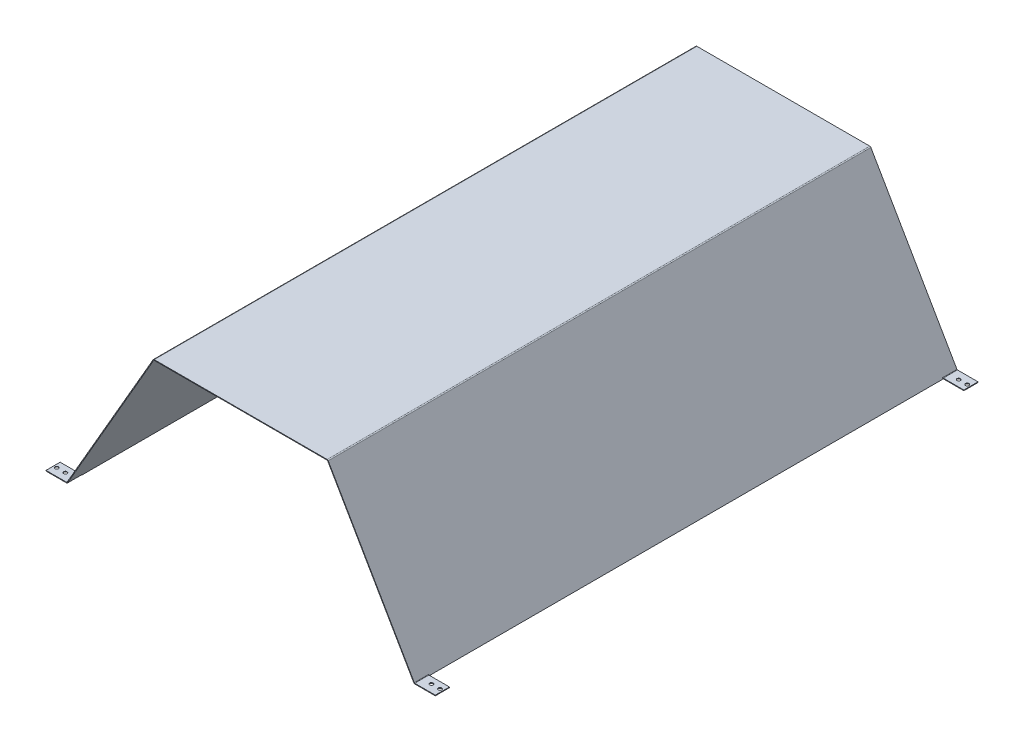
from build123d import *

# Parameters (mm, degrees)
EXTRUDE_1_DEPTH          = 633
EXTRUDE_1_DEPTH_BACK     = 633
SHEET_START              = -633
SHEET_METAL_1_DEPTH      = 1266
SHEET_METAL_1_2_DEPTH    = 1266
SM_START                 = -633
SM_EDGE_FLANGE_1_DEPTH   = 33.75
SM_START_2               = -600
SM_EDGE_FLANGE_1_2_DEPTH = 0.75
SM_EDGE_FLANGE_1_3_DEPTH = 33
MIRROR_START             = -633
MIRROR_2_COPY_1_DEPTH    = 33.75
MIRROR_START_2           = -600
MIRROR_2_COPY_2_DEPTH    = 0.75
MIRROR_2_COPY_3_DEPTH    = 33
MIRROR_2_COPY_4_DEPTH    = 0.75
MIRROR_2_COPY_5_DEPTH    = 33
CUT_EXTRUDE_1_REACH      = 856.061
SKETCH_9_R               = 4


# Read off the part's stored shape, not the designer's step: Преобразовать-Твердое тело1, Ребро-кромка1
with BuildPart() as part:
    # Sketch 1 → Вытянуть-Тонкостенный1 (new, two sides: drawn at the far end of the back side and taken through both)
    with BuildSketch(Plane.XY.offset(-EXTRUDE_1_DEPTH_BACK)):
        Polygon((405, 6), (202.5, 356.740288533), (-202.5, 356.740288533), (-405, 6), (-406.299038106, 6.75), (-203.366025404, 358.240288533), (203.366025404, 358.240288533), (406.299038106, 6.75), align=None)
    extrude(amount=EXTRUDE_1_DEPTH + EXTRUDE_1_DEPTH_BACK)

    # Sheet Metal 1 outline → Sheet Metal 1 (cut)
    with BuildSketch(Plane.XY.offset(SHEET_START)):
        with BuildLine():
            Line((203.366025404, 358.240288533), (201.633974596, 358.240288533))
            ThreePointArc((201.633974596, 358.240288533), (203.133974596, 357.838364744), (204.232050808, 356.740288533))
            Line((204.232050808, 356.740288533), (203.366025404, 358.240288533))
        make_face()
        with BuildLine():
            ThreePointArc((-204.232050808, 356.740288533), (-203.133974596, 357.838364744), (-201.633974596, 358.240288533))
            Line((-201.633974596, 358.240288533), (-203.366025404, 358.240288533))
            Line((-203.366025404, 358.240288533), (-204.232050808, 356.740288533))
        make_face()
    extrude(amount=SHEET_METAL_1_DEPTH, mode=Mode.SUBTRACT)

    # Sheet Metal 1 2 outline → Sheet Metal 1 2 (add)
    with BuildSketch(Plane.XY.offset(SHEET_START)):
        with BuildLine():
            Line((202.5, 356.740288533), (201.633974596, 356.740288533))
            ThreePointArc((201.633974596, 356.740288533), (202.383974596, 356.539326638), (202.933012702, 355.990288533))
            Line((202.933012702, 355.990288533), (202.5, 356.740288533))
        make_face()
        with BuildLine():
            ThreePointArc((-202.933012702, 355.990288533), (-202.383974596, 356.539326638), (-201.633974596, 356.740288533))
            Line((-201.633974596, 356.740288533), (-202.5, 356.740288533))
            Line((-202.5, 356.740288533), (-202.933012702, 355.990288533))
        make_face()
    extrude(amount=SHEET_METAL_1_2_DEPTH)

    # Ребро-кромка1 outline → Ребро-кромка1 (cut)
    with BuildSketch(Plane.XY.offset(SM_START)):
        with BuildLine():
            Line((-405, 6), (-403.700961894, 8.25))
            ThreePointArc((-403.700961894, 8.25), (-404.799038106, 7.151923789), (-406.299038106, 6.75))
            Line((-406.299038106, 6.75), (-405, 6))
        make_face()
    sm_edge_flange_1 = extrude(amount=SM_EDGE_FLANGE_1_DEPTH, mode=Mode.SUBTRACT)

    # Sm Edge Flange 1 2 outline → Sm Edge Flange 1 2 (cut)
    with BuildSketch(Plane.XY.offset(SM_START_2)):
        with BuildLine():
            Line((-403.325961894, 8.899519053), (-404.625, 9.649519053))
            Line((-404.625, 9.649519053), (-406.299038106, 6.75))
            ThreePointArc((-406.299038106, 6.75), (-404.799038106, 7.151923789), (-403.700961894, 8.25))
            Line((-403.700961894, 8.25), (-403.325961894, 8.899519053))
        make_face()
    sm_edge_flange_1_2 = extrude(amount=SM_EDGE_FLANGE_1_2_DEPTH, mode=Mode.SUBTRACT)

    # Sm Edge Flange 1 3 outline → Sm Edge Flange 1 3 (add)
    with BuildSketch(Plane.XY.offset(SM_START)):
        with BuildLine():
            Line((-406.299038106, 6.75), (-405, 9))
            ThreePointArc((-405, 9), (-405.549038106, 8.450961894), (-406.299038106, 8.25))
            Line((-406.299038106, 8.25), (-454.133974596, 8.25))
            Line((-454.133974596, 8.25), (-454.133974596, 6.75))
            Line((-454.133974596, 6.75), (-406.299038106, 6.75))
        make_face()
    sm_edge_flange_1_3 = extrude(amount=SM_EDGE_FLANGE_1_3_DEPTH)

    # Зеркальное отражение1: Ребро-кромка1, Sm Edge Flange 1 2, Sm Edge Flange 1 3 across plane
    add(sm_edge_flange_1.mirror(Plane.XY), mode=Mode.SUBTRACT)
    add(sm_edge_flange_1_2.mirror(Plane.XY), mode=Mode.SUBTRACT)
    add(sm_edge_flange_1_3.mirror(Plane.XY))

    # Зеркальное отражение2: Ребро-кромка1, Sm Edge Flange 1 2, Sm Edge Flange 1 3 across plane
    add(sm_edge_flange_1.mirror(Plane(origin=(0, 0, 0), x_dir=(0, 0, 1), z_dir=(1, 0, 0))), mode=Mode.SUBTRACT)
    add(sm_edge_flange_1_2.mirror(Plane(origin=(0, 0, 0), x_dir=(0, 0, 1), z_dir=(1, 0, 0))), mode=Mode.SUBTRACT)
    add(sm_edge_flange_1_3.mirror(Plane(origin=(0, 0, 0), x_dir=(0, 0, 1), z_dir=(1, 0, 0))))

    # Зеркальное отражение2 copy 1 sketch → Зеркальное отражение2 copy 1 (cut)
    with BuildSketch(Plane(origin=(0, 0, 0), x_dir=(-1, 0, 0), z_dir=(0, 0, -1)).offset(MIRROR_START)):
        with BuildLine():
            Line((-405, 6), (-403.700961894, 8.25))
            ThreePointArc((-403.700961894, 8.25), (-404.799038106, 7.151923789), (-406.299038106, 6.75))
            Line((-406.299038106, 6.75), (-405, 6))
        make_face()
    extrude(amount=MIRROR_2_COPY_1_DEPTH, mode=Mode.SUBTRACT)

    # Зеркальное отражение2 copy 2 sketch → Зеркальное отражение2 copy 2 (cut)
    with BuildSketch(Plane(origin=(0, 0, 0), x_dir=(-1, 0, 0), z_dir=(0, 0, -1)).offset(MIRROR_START_2)):
        with BuildLine():
            Line((-403.325961894, 8.899519053), (-404.625, 9.649519053))
            Line((-404.625, 9.649519053), (-406.299038106, 6.75))
            ThreePointArc((-406.299038106, 6.75), (-404.799038106, 7.151923789), (-403.700961894, 8.25))
            Line((-403.700961894, 8.25), (-403.325961894, 8.899519053))
        make_face()
    extrude(amount=MIRROR_2_COPY_2_DEPTH, mode=Mode.SUBTRACT)

    # Зеркальное отражение2 copy 3 sketch → Зеркальное отражение2 copy 3 (add)
    with BuildSketch(Plane(origin=(0, 0, 0), x_dir=(-1, 0, 0), z_dir=(0, 0, -1)).offset(MIRROR_START)):
        with BuildLine():
            Line((-406.299038106, 6.75), (-405, 9))
            ThreePointArc((-405, 9), (-405.549038106, 8.450961894), (-406.299038106, 8.25))
            Line((-406.299038106, 8.25), (-454.133974596, 8.25))
            Line((-454.133974596, 8.25), (-454.133974596, 6.75))
            Line((-454.133974596, 6.75), (-406.299038106, 6.75))
        make_face()
    extrude(amount=MIRROR_2_COPY_3_DEPTH)

    # Зеркальное отражение2 copy 4 sketch → Зеркальное отражение2 copy 4 (cut)
    with BuildSketch(Plane(origin=(0, 0, 0), x_dir=(-1, 0, 0), z_dir=(0, 0, 1)).offset(MIRROR_START_2)):
        with BuildLine():
            Line((-403.325961894, -8.899519053), (-404.625, -9.649519053))
            Line((-404.625, -9.649519053), (-406.299038106, -6.75))
            ThreePointArc((-406.299038106, -6.75), (-404.799038106, -7.151923789), (-403.700961894, -8.25))
            Line((-403.700961894, -8.25), (-403.325961894, -8.899519053))
        make_face()
    extrude(amount=MIRROR_2_COPY_4_DEPTH, mode=Mode.SUBTRACT)

    # Зеркальное отражение2 copy 5 sketch → Зеркальное отражение2 copy 5 (add)
    with BuildSketch(Plane(origin=(0, 0, 0), x_dir=(-1, 0, 0), z_dir=(0, 0, 1)).offset(MIRROR_START)):
        with BuildLine():
            Line((-406.299038106, -6.75), (-405, -9))
            ThreePointArc((-405, -9), (-405.549038106, -8.450961894), (-406.299038106, -8.25))
            Line((-406.299038106, -8.25), (-454.133974596, -8.25))
            Line((-454.133974596, -8.25), (-454.133974596, -6.75))
            Line((-454.133974596, -6.75), (-406.299038106, -6.75))
        make_face()
    extrude(amount=MIRROR_2_COPY_5_DEPTH)

    # Эскиз9 → Вырез-Вытянуть1 (cut, up to next)
    with BuildSketch(Plane(origin=(0, 8.25, 0), x_dir=(1, 0, 0), z_dir=(0, 1, 0)), mode=Mode.PRIVATE) as cut_extrude_1_sk1:
        with Locations(Location((-447, 615, 0), (0, 0, 180))):
            Circle(SKETCH_9_R)
    cut_extrude_1_tool1 = extrude(cut_extrude_1_sk1.sketch, amount=-CUT_EXTRUDE_1_REACH, mode=Mode.PRIVATE) & part.part
    # Эскиз9 → Вырез-Вытянуть1 (cut, up to next)
    with BuildSketch(Plane(origin=(0, 8.25, 0), x_dir=(1, 0, 0), z_dir=(0, 1, 0)), mode=Mode.PRIVATE) as cut_extrude_1_sk2:
        with Locations(Location((-427, 615, 0), (0, 0, 180))):
            Circle(SKETCH_9_R)
    cut_extrude_1_tool2 = extrude(cut_extrude_1_sk2.sketch, amount=-CUT_EXTRUDE_1_REACH, mode=Mode.PRIVATE) & part.part
    # Эскиз9 → Вырез-Вытянуть1 (cut, up to next)
    with BuildSketch(Plane(origin=(0, 8.25, 0), x_dir=(1, 0, 0), z_dir=(0, 1, 0)), mode=Mode.PRIVATE) as cut_extrude_1_sk3:
        with Locations(Location((-447, -615, 0), (0, 0, 180))):
            Circle(SKETCH_9_R)
    cut_extrude_1_tool3 = extrude(cut_extrude_1_sk3.sketch, amount=-CUT_EXTRUDE_1_REACH, mode=Mode.PRIVATE) & part.part
    # Эскиз9 → Вырез-Вытянуть1 (cut, up to next)
    with BuildSketch(Plane(origin=(0, 8.25, 0), x_dir=(1, 0, 0), z_dir=(0, 1, 0)), mode=Mode.PRIVATE) as cut_extrude_1_sk4:
        with Locations(Location((-427, -615, 0), (0, 0, 180))):
            Circle(SKETCH_9_R)
    cut_extrude_1_tool4 = extrude(cut_extrude_1_sk4.sketch, amount=-CUT_EXTRUDE_1_REACH, mode=Mode.PRIVATE) & part.part
    # Эскиз9 → Вырез-Вытянуть1 (cut, up to next)
    with BuildSketch(Plane(origin=(0, 8.25, 0), x_dir=(1, 0, 0), z_dir=(0, 1, 0)), mode=Mode.PRIVATE) as cut_extrude_1_sk5:
        with Locations(Location((427, -615, 0), (0, 0, 180))):
            Circle(SKETCH_9_R)
    cut_extrude_1_tool5 = extrude(cut_extrude_1_sk5.sketch, amount=-CUT_EXTRUDE_1_REACH, mode=Mode.PRIVATE) & part.part
    # Эскиз9 → Вырез-Вытянуть1 (cut, up to next)
    with BuildSketch(Plane(origin=(0, 8.25, 0), x_dir=(1, 0, 0), z_dir=(0, 1, 0)), mode=Mode.PRIVATE) as cut_extrude_1_sk6:
        with Locations(Location((447, -615, 0), (0, 0, 180))):
            Circle(SKETCH_9_R)
    cut_extrude_1_tool6 = extrude(cut_extrude_1_sk6.sketch, amount=-CUT_EXTRUDE_1_REACH, mode=Mode.PRIVATE) & part.part
    # Эскиз9 → Вырез-Вытянуть1 (cut, up to next)
    with BuildSketch(Plane(origin=(0, 8.25, 0), x_dir=(1, 0, 0), z_dir=(0, 1, 0)), mode=Mode.PRIVATE) as cut_extrude_1_sk7:
        with Locations(Location((427, 615, 0), (0, 0, 180))):
            Circle(SKETCH_9_R)
    cut_extrude_1_tool7 = extrude(cut_extrude_1_sk7.sketch, amount=-CUT_EXTRUDE_1_REACH, mode=Mode.PRIVATE) & part.part
    # Эскиз9 → Вырез-Вытянуть1 (cut, up to next)
    with BuildSketch(Plane(origin=(0, 8.25, 0), x_dir=(1, 0, 0), z_dir=(0, 1, 0)), mode=Mode.PRIVATE) as cut_extrude_1_sk8:
        with Locations(Location((447, 615, 0), (0, 0, 180))):
            Circle(SKETCH_9_R)
    cut_extrude_1_tool8 = extrude(cut_extrude_1_sk8.sketch, amount=-CUT_EXTRUDE_1_REACH, mode=Mode.PRIVATE) & part.part
    add(cut_extrude_1_tool1.solids().sort_by_distance((-447, 8.25, -615))[0], mode=Mode.SUBTRACT)
    add(cut_extrude_1_tool2.solids().sort_by_distance((-427, 8.25, -615))[0], mode=Mode.SUBTRACT)
    add(cut_extrude_1_tool3.solids().sort_by_distance((-447, 8.25, 615))[0], mode=Mode.SUBTRACT)
    add(cut_extrude_1_tool4.solids().sort_by_distance((-427, 8.25, 615))[0], mode=Mode.SUBTRACT)
    add(cut_extrude_1_tool5.solids().sort_by_distance((427, 8.25, 615))[0], mode=Mode.SUBTRACT)
    add(cut_extrude_1_tool6.solids().sort_by_distance((447, 8.25, 615))[0], mode=Mode.SUBTRACT)
    add(cut_extrude_1_tool7.solids().sort_by_distance((427, 8.25, -615))[0], mode=Mode.SUBTRACT)
    add(cut_extrude_1_tool8.solids().sort_by_distance((447, 8.25, -615))[0], mode=Mode.SUBTRACT)


solid = part.part
